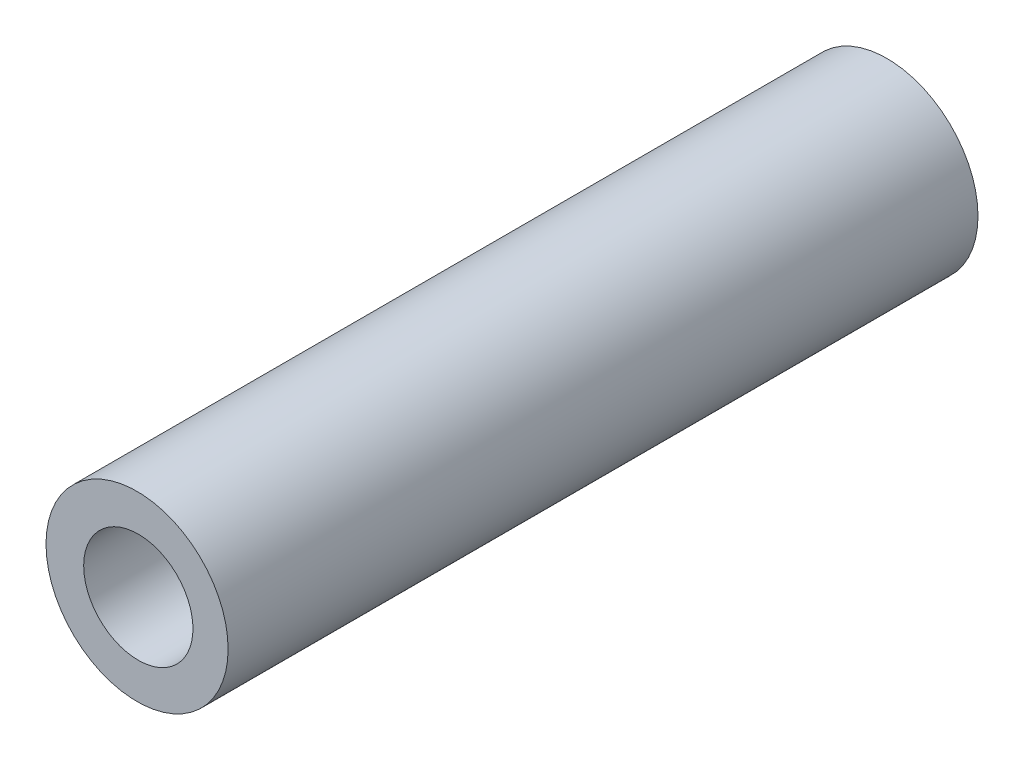
from build123d import *

# Parameters (mm, degrees)
ESQUISSE1_R        = 2.5
ESQUISSE1_R_2      = 1.5
BOSS_EXTRU_1_DEPTH = 20.59


with BuildPart() as part:
    # Esquisse1 → Boss.-Extru.1 (new body)
    with BuildSketch(Plane.XY):
        with Locations((-0.034281653, 0)):
            Circle(ESQUISSE1_R)
        Circle(ESQUISSE1_R_2, mode=Mode.SUBTRACT)
    extrude(amount=BOSS_EXTRU_1_DEPTH)


solid = part.part
